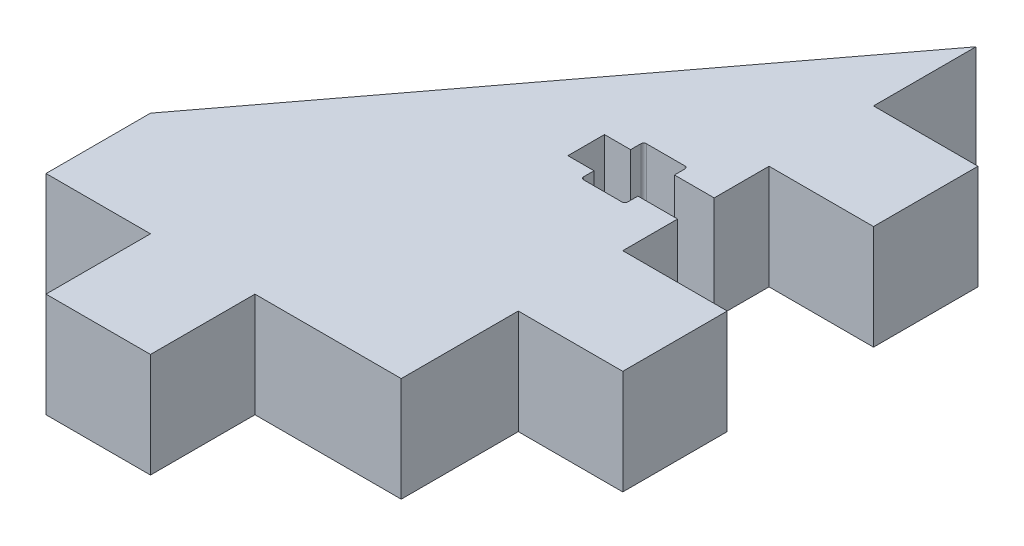
from build123d import *

# Parameters (mm, degrees)
BOSS_EXTRUDE1_DEPTH = 10
CUT_EXTRUDE1_DEPTH  = 66.429351212


with BuildPart() as part:
    # Sketch1 → Boss-Extrude1 (new body)
    with BuildSketch(Plane(origin=(0, 0, 0), x_dir=(1, 0, 0), z_dir=(0, 1, 0))):
        Polygon((0, 0), (-14, 0), (-14, -10), (-24, -10), (-24, 0), (-34, 0), (-34, 10), (0, 55), (0, 45.2), (10, 45.2), (10, 35.2), (0, 35.2), (0, 21.2), (10, 21.2), (10, 11.2), (0, 11.2), align=None)
    extrude(amount=BOSS_EXTRUDE1_DEPTH)

    # Sketch3 → Cut-Extrude1 (cut, through all)
    with BuildSketch(Plane(origin=(0, 10, 0), x_dir=(1, 0, 0), z_dir=(0, 1, 0))):
        with BuildLine():
            Line((-10.5, 29.95), (-8, 29.95))
            Line((-8, 29.95), (-8, 30.95))
            ThreePointArc((-8, 30.95), (-7.926776695, 31.126776695), (-7.75, 31.2))
            Line((-7.75, 31.2), (-4.05, 31.2))
            ThreePointArc((-4.05, 31.2), (-3.873223305, 31.126776695), (-3.8, 30.95))
            Line((-3.8, 30.95), (-3.8, 29.95))
            Line((-3.8, 29.95), (0, 29.95))
            Line((0, 29.95), (0, 26.45))
            Line((0, 26.45), (-3.8, 26.45))
            Line((-3.8, 26.45), (-3.8, 25.45))
            ThreePointArc((-3.8, 25.45), (-3.873223305, 25.273223305), (-4.05, 25.2))
            Line((-4.05, 25.2), (-7.75, 25.2))
            ThreePointArc((-7.75, 25.2), (-7.926776695, 25.273223305), (-8, 25.45))
            Line((-8, 25.45), (-8, 26.45))
            Line((-8, 26.45), (-10.5, 26.45))
            Line((-10.5, 26.45), (-10.5, 29.95))
        make_face()
    extrude(amount=-CUT_EXTRUDE1_DEPTH, mode=Mode.SUBTRACT)


solid = part.part
